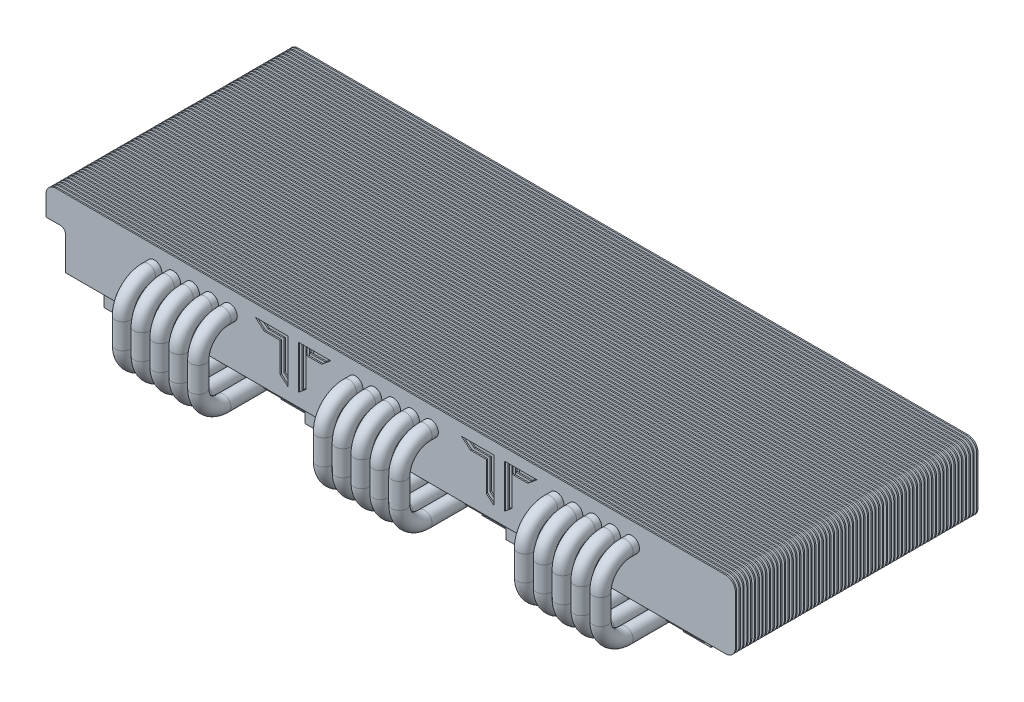
from build123d import *

# Parameters (mm, degrees)
SKETCH1_W             = 11
SKETCH1_H             = 65.4
BOSS_EXTRUDE1_DEPTH   = 4
BOSS_EXTRUDE1_2_DEPTH = 4
SKETCH1_W_2           = 38
SKETCH1_H_2           = 38
BOSS_EXTRUDE1_3_DEPTH = 4
BOSS_EXTRUDE1_4_DEPTH = 4
BOSS_EXTRUDE1_5_DEPTH = 4
BOSS_EXTRUDE1_6_DEPTH = 4
BOSS_EXTRUDE1_7_DEPTH = 4
BOSS_EXTRUDE1_8_DEPTH = 4
BOSS_EXTRUDE1_9_DEPTH = 4
SKETCH2_W             = 277
SKETCH2_H             = 106
BOSS_EXTRUDE2_DEPTH   = 6
SKETCH4_W             = 38
SKETCH4_H             = 38
SKETCH4_W_2           = 11
SKETCH4_H_2           = 65.4
CUT_EXTRUDE1_DEPTH    = 1
SKETCH5_W             = 277
SKETCH5_H             = 106
CUT_EXTRUDE2_DEPTH    = 6
SKETCH6_R             = 3
LPATTERN1_COUNT       = 5
LPATTERN1_PITCH       = 7.5
SKETCH7_R             = 3
LPATTERN7_COUNT       = 5
LPATTERN7_PITCH       = 7.5
SKETCH8_R             = 3
LPATTERN8_COUNT       = 5
LPATTERN8_PITCH       = 7.5
SKETCH9_W             = 238.9
SKETCH9_H             = 68
BOSS_EXTRUDE3_DEPTH   = 4
BOSS_EXTRUDE4_DEPTH   = 0.5
LPATTERN9_COUNT       = 65
LPATTERN9_PITCH       = 1.5
CUT_EXTRUDE3_DEPTH    = 99
CUT_EXTRUDE4_DEPTH    = 99


with BuildPart() as part:
    # Sketch1 → Boss-Extrude1 (new body)
    with BuildSketch(Plane(origin=(0, 0, 0), x_dir=(1, 0, 0), z_dir=(0, 1, 0))):
        with Locations((-5.5, 0)):
            Rectangle(SKETCH1_W, SKETCH1_H)
    extrude(amount=-BOSS_EXTRUDE1_DEPTH)



with BuildPart() as body_2:
    # Sketch1 → Boss-Extrude1 2 (new body)
    with BuildSketch(Plane(origin=(0, 0, 0), x_dir=(1, 0, 0), z_dir=(0, 1, 0))):
        Polygon((-12.4, 32.7), (-78.9, 32.7), (-78.9, -35.3), (-61.9, -35.3), (-61.9, 16.55), (-12.4, 16.55), align=None)
    extrude(amount=-BOSS_EXTRUDE1_2_DEPTH)


with BuildPart() as body_3:
    # Sketch1 → Boss-Extrude1 3 (new body)
    with BuildSketch(Plane(origin=(0, 0, 0), x_dir=(1, 0, 0), z_dir=(0, 1, 0))):
        with Locations((-33.15, -8.95)):
            Rectangle(SKETCH1_W_2, SKETCH1_H_2)
    extrude(amount=-BOSS_EXTRUDE1_3_DEPTH)


with BuildPart() as body_4:
    # Sketch1 → Boss-Extrude1 4 (new body)
    with BuildSketch(Plane(origin=(0, 0, 0), x_dir=(1, 0, 0), z_dir=(0, 1, 0))):
        with Locations((74.5, 0)):
            Rectangle(SKETCH1_W, SKETCH1_H)
    extrude(amount=-BOSS_EXTRUDE1_4_DEPTH)


with BuildPart() as body_5:
    # Sketch1 → Boss-Extrude1 5 (new body)
    with BuildSketch(Plane(origin=(0, 0, 0), x_dir=(1, 0, 0), z_dir=(0, 1, 0))):
        Polygon((67.6, 32.7), (1.1, 32.7), (1.1, -35.3), (18.1, -35.3), (18.1, 16.55), (67.6, 16.55), align=None)
    extrude(amount=-BOSS_EXTRUDE1_5_DEPTH)


with BuildPart() as body_6:
    # Sketch1 → Boss-Extrude1 6 (new body)
    with BuildSketch(Plane(origin=(0, 0, 0), x_dir=(1, 0, 0), z_dir=(0, 1, 0))):
        with Locations((46.85, -8.95)):
            Rectangle(SKETCH1_W_2, SKETCH1_H_2)
    extrude(amount=-BOSS_EXTRUDE1_6_DEPTH)


with BuildPart() as body_7:
    # Sketch1 → Boss-Extrude1 7 (new body)
    with BuildSketch(Plane(origin=(0, 0, 0), x_dir=(1, 0, 0), z_dir=(0, 1, 0))):
        with Locations((154.5, 0)):
            Rectangle(SKETCH1_W, SKETCH1_H)
    extrude(amount=-BOSS_EXTRUDE1_7_DEPTH)


with BuildPart() as body_8:
    # Sketch1 → Boss-Extrude1 8 (new body)
    with BuildSketch(Plane(origin=(0, 0, 0), x_dir=(1, 0, 0), z_dir=(0, 1, 0))):
        Polygon((147.6, 32.7), (81.1, 32.7), (81.1, -35.3), (98.1, -35.3), (98.1, 16.55), (147.6, 16.55), align=None)
    extrude(amount=-BOSS_EXTRUDE1_8_DEPTH)


with BuildPart() as body_9:
    # Sketch1 → Boss-Extrude1 9 (new body)
    with BuildSketch(Plane(origin=(0, 0, 0), x_dir=(1, 0, 0), z_dir=(0, 1, 0))):
        with Locations((126.85, -8.95)):
            Rectangle(SKETCH1_W_2, SKETCH1_H_2)
    extrude(amount=-BOSS_EXTRUDE1_9_DEPTH)


with BuildPart() as part_1:
    add(part.part)

    add(body_2.part)  # Boss-Extrude2 merges body 2

    add(body_3.part)  # Boss-Extrude2 merges body 3

    add(body_4.part)  # Boss-Extrude2 merges body 4

    add(body_5.part)  # Boss-Extrude2 merges body 5

    add(body_6.part)  # Boss-Extrude2 merges body 6

    add(body_7.part)  # Boss-Extrude2 merges body 7

    add(body_8.part)  # Boss-Extrude2 merges body 8

    add(body_9.part)  # Boss-Extrude2 merges body 9
    # Sketch2 → Boss-Extrude2 (add)
    with BuildSketch(Plane(origin=(0, 0, 0), x_dir=(1, 0, 0), z_dir=(0, 1, 0))):
        with Locations((41.6, -5.35)):
            Rectangle(SKETCH2_W, SKETCH2_H)
    extrude(amount=BOSS_EXTRUDE2_DEPTH)

    # Sketch4 → Cut-Extrude1 (cut)
    with BuildSketch(Plane.XZ.offset(4)):
        with Locations((-33.15, 8.95)):
            Rectangle(SKETCH4_W, SKETCH4_H)
        with Locations((-5.5, 0)):
            Rectangle(SKETCH4_W_2, SKETCH4_H_2)
        with Locations((46.85, 8.95)):
            Rectangle(SKETCH4_W, SKETCH4_H)
        with Locations((74.5, 0)):
            Rectangle(SKETCH4_W_2, SKETCH4_H_2)
        with Locations((126.85, 8.95)):
            Rectangle(SKETCH4_W, SKETCH4_H)
        with Locations((154.5, 0)):
            Rectangle(SKETCH4_W_2, SKETCH4_H_2)
    extrude(amount=-CUT_EXTRUDE1_DEPTH, mode=Mode.SUBTRACT)

    # Sketch5 → Cut-Extrude2 (cut)
    with BuildSketch(Plane(origin=(0, 6, 0), x_dir=(1, 0, 0), z_dir=(0, 1, 0))):
        with Locations((41.6, -5.35)):
            Rectangle(SKETCH5_W, SKETCH5_H)
    extrude(amount=-CUT_EXTRUDE2_DEPTH, mode=Mode.SUBTRACT)


with BuildPart() as cut_extrude2_piece_1:
    # of the separate pieces the step leaves, piece 1, a body of its own (cut_extrude2_pieces)
    add(part_1.part.solids().sort_by_distance((147.6, 0, -32.7))[0])



with BuildPart() as cut_extrude2_piece_2:
    # of the separate pieces the step leaves, piece 2, a body of its own (cut_extrude2_pieces)
    add(part_1.part.solids().sort_by_distance((-12.4, 0, -32.7))[0])


with BuildPart() as cut_extrude2_piece_3:
    # of the separate pieces the step leaves, piece 3, a body of its own (cut_extrude2_pieces)
    add(part_1.part.solids().sort_by_distance((67.6, 0, -32.7))[0])


with BuildPart() as cut_extrude2_piece_4:
    # of the separate pieces the step leaves, piece 4, a body of its own (cut_extrude2_pieces)
    add(part_1.part.solids().sort_by_distance((65.85, 0, -10.05))[0])

    # Sweep2: sweep along a curve in space
    with BuildLine() as sweep2_path:
        Line((31.7, 0, 27.95), (31.7, 0, 48.35))
        ThreePointArc((31.7, 0, 48.35), (31.7, 2.928932188, 55.421067812), (31.7, 10, 58.35))
        Line((31.7, 10, 58.35), (31.7, 20, 58.35))
        ThreePointArc((31.7, 20, 58.35), (31.7, 27.071067812, 55.421067812), (31.7, 30, 48.35))
        Line((31.7, 30, 48.35), (31.7, 30, -51.65))
    # Sketch7 → Sweep2 (sweep)
    with BuildSketch(Plane.XY.offset(27.95)):
        with Locations((31.7, 0)):
            Circle(SKETCH7_R)
    sweep2 = sweep(path=sweep2_path.line)

    # LPattern7: Sweep2 ×5
    with Locations(*[(i * LPATTERN7_PITCH, 0, 0) for i in range(1, LPATTERN7_COUNT)]):
        add(sweep2)


with BuildPart() as cut_extrude2_piece_5:
    # of the separate pieces the step leaves, piece 5, a body of its own (cut_extrude2_pieces)
    add(part_1.part.solids().sort_by_distance((-14.15, 0, -10.05))[0])

    # Sweep1: sweep along a curve in space
    with BuildLine() as sweep1_path:
        Line((-48.3, 0, 27.95), (-48.3, 0, 48.35))
        ThreePointArc((-48.3, 0, 48.35), (-48.3, 2.928932188, 55.421067812), (-48.3, 10, 58.35))
        Line((-48.3, 10, 58.35), (-48.3, 20, 58.35))
        ThreePointArc((-48.3, 20, 58.35), (-48.3, 27.071067812, 55.421067812), (-48.3, 30, 48.35))
        Line((-48.3, 30, 48.35), (-48.3, 30, -51.65))
    # Sketch6 → Sweep1 (sweep)
    with BuildSketch(Plane.XY.offset(27.95)):
        with Locations((-48.3, 0)):
            Circle(SKETCH6_R)
    sweep1 = sweep(path=sweep1_path.line)

    # LPattern1: Sweep1 ×5
    with Locations(*[(i * LPATTERN1_PITCH, 0, 0) for i in range(1, LPATTERN1_COUNT)]):
        add(sweep1)


with BuildPart() as cut_extrude2_piece_6:
    # of the separate pieces the step leaves, piece 6, a body of its own (cut_extrude2_pieces)
    add(part_1.part.solids().sort_by_distance((145.85, 0, -10.05))[0])

    # Sweep3: sweep along a curve in space
    with BuildLine() as sweep3_path:
        Line((111.7, 0, 27.95), (111.7, 0, 48.35))
        ThreePointArc((111.7, 0, 48.35), (111.7, 2.928932188, 55.421067812), (111.7, 10, 58.35))
        Line((111.7, 10, 58.35), (111.7, 20, 58.35))
        ThreePointArc((111.7, 20, 58.35), (111.7, 27.071067812, 55.421067812), (111.7, 30, 48.35))
        Line((111.7, 30, 48.35), (111.7, 30, -51.65))
    # Sketch8 → Sweep3 (sweep)
    with BuildSketch(Plane.XY.offset(27.95)):
        with Locations((111.7, 0)):
            Circle(SKETCH8_R)
    sweep3 = sweep(path=sweep3_path.line)

    # LPattern8: Sweep3 ×5
    with Locations(*[(i * LPATTERN8_PITCH, 0, 0) for i in range(1, LPATTERN8_COUNT)]):
        add(sweep3)


with BuildPart() as cut_extrude2_piece_7:
    # of the separate pieces the step leaves, piece 7, a body of its own (cut_extrude2_pieces)
    add(part_1.part.solids().sort_by_distance((0, 0, 32.7))[0])


with BuildPart() as cut_extrude2_piece_8:
    # of the separate pieces the step leaves, piece 8, a body of its own (cut_extrude2_pieces)
    add(part_1.part.solids().sort_by_distance((80, 0, 32.7))[0])


with BuildPart() as cut_extrude2_piece_9:
    # of the separate pieces the step leaves, piece 9, a body of its own (cut_extrude2_pieces)
    add(part_1.part.solids().sort_by_distance((160, 0, 32.7))[0])


with BuildPart() as cut_extrude2_piece_1_1:
    add(cut_extrude2_piece_1.part)

    add(cut_extrude2_piece_2.part)  # Boss-Extrude3 merges Cut-Extrude2 piece 2

    add(cut_extrude2_piece_3.part)  # Boss-Extrude3 merges Cut-Extrude2 piece 3

    add(cut_extrude2_piece_4.part)  # Boss-Extrude3 merges Cut-Extrude2 piece 4

    add(cut_extrude2_piece_5.part)  # Boss-Extrude3 merges Cut-Extrude2 piece 5

    add(cut_extrude2_piece_6.part)  # Boss-Extrude3 merges Cut-Extrude2 piece 6

    add(cut_extrude2_piece_7.part)  # Boss-Extrude3 merges Cut-Extrude2 piece 7

    add(cut_extrude2_piece_8.part)  # Boss-Extrude3 merges Cut-Extrude2 piece 8

    add(cut_extrude2_piece_9.part)  # Boss-Extrude3 merges Cut-Extrude2 piece 9
    # Sketch9 → Boss-Extrude3 (add)
    with BuildSketch(Plane(origin=(0, 0, 0), x_dir=(1, 0, 0), z_dir=(0, 1, 0))):
        with Locations((40.55, -1.3)):
            Rectangle(SKETCH9_W, SKETCH9_H)
    extrude(amount=BOSS_EXTRUDE3_DEPTH)

    # Sketch10 → Boss-Extrude4 (add)
    with BuildSketch(Plane(origin=(0, 0, -50.65), x_dir=(-1, 0, 0), z_dir=(0, 0, -1))):
        with BuildLine():
            Line((-178.898759527, 38.098707817), (87.4, 38.098707817))
            ThreePointArc((87.4, 38.098707817), (90.228427125, 36.927134942), (91.4, 34.098707817))
            Line((91.4, 34.098707817), (91.4, 14.878408396))
            ThreePointArc((91.4, 14.878408396), (90.228427125, 12.049981271), (87.4, 10.878408396))
            Line((87.4, 10.878408396), (-178.898759527, 10.878408396))
            ThreePointArc((-178.898759527, 10.878408396), (-181.727186652, 12.049981271), (-182.898759527, 14.878408396))
            Line((-182.898759527, 14.878408396), (-182.898759527, 34.098707817))
            ThreePointArc((-182.898759527, 34.098707817), (-181.727186652, 36.927134942), (-178.898759527, 38.098707817))
        make_face()
    boss_extrude4 = extrude(amount=-BOSS_EXTRUDE4_DEPTH)

    # LPattern9: Boss-Extrude4 ×65
    with Locations(*[(0, 0, i * LPATTERN9_PITCH) for i in range(1, LPATTERN9_COUNT)]):
        add(boss_extrude4)

    # Sketch11 → Cut-Extrude3 (cut)
    with BuildSketch(Plane(origin=(0, 0, -50.65), x_dir=(-1, 0, 0), z_dir=(0, 0, -1))):
        with BuildLine():
            Line((91.4, 26.178408396), (85.65, 26.178408396))
            ThreePointArc((85.65, 26.178408396), (84.235786438, 25.592621958), (83.65, 24.178408396))
            Line((83.65, 24.178408396), (83.65, 10.878408396))
            Line((83.65, 10.878408396), (91.4, 10.878408396))
            Line((91.4, 10.878408396), (91.4, 26.178408396))
        make_face()
    extrude(amount=-CUT_EXTRUDE3_DEPTH, mode=Mode.SUBTRACT)

    # Sketch12 → Cut-Extrude4 (cut)
    with BuildSketch(Plane(origin=(0, 0, -50.65), x_dir=(-1, 0, 0), z_dir=(0, 0, -1))):
        Polygon((-103.883318762, 33.305489936), (-100.287660435, 30.305489936), (-93.963348759, 30.305489936), (-93.963348759, 18.462906307), (-90.963348759, 15.959887615), (-90.963348759, 33.305489936), align=None)
        Polygon((-83.794847632, 18.462906307), (-86.794847632, 15.959887615), (-86.794847632, 33.305489936), (-73.87487763, 33.305489936), (-77.470535956, 30.305489936), (-83.794847632, 30.305489936), align=None)
        Polygon((-21.883318762, 33.305489936), (-18.287660435, 30.305489936), (-11.963348759, 30.305489936), (-11.963348759, 18.462906307), (-8.963348759, 15.959887615), (-8.963348759, 33.305489936), align=None)
        Polygon((-1.794847632, 18.462906307), (-4.794847632, 15.959887615), (-4.794847632, 33.305489936), (8.12512237, 33.305489936), (4.529464044, 30.305489936), (-1.794847632, 30.305489936), align=None)
    extrude(amount=-CUT_EXTRUDE4_DEPTH, mode=Mode.SUBTRACT)


solid = cut_extrude2_piece_1_1.part
